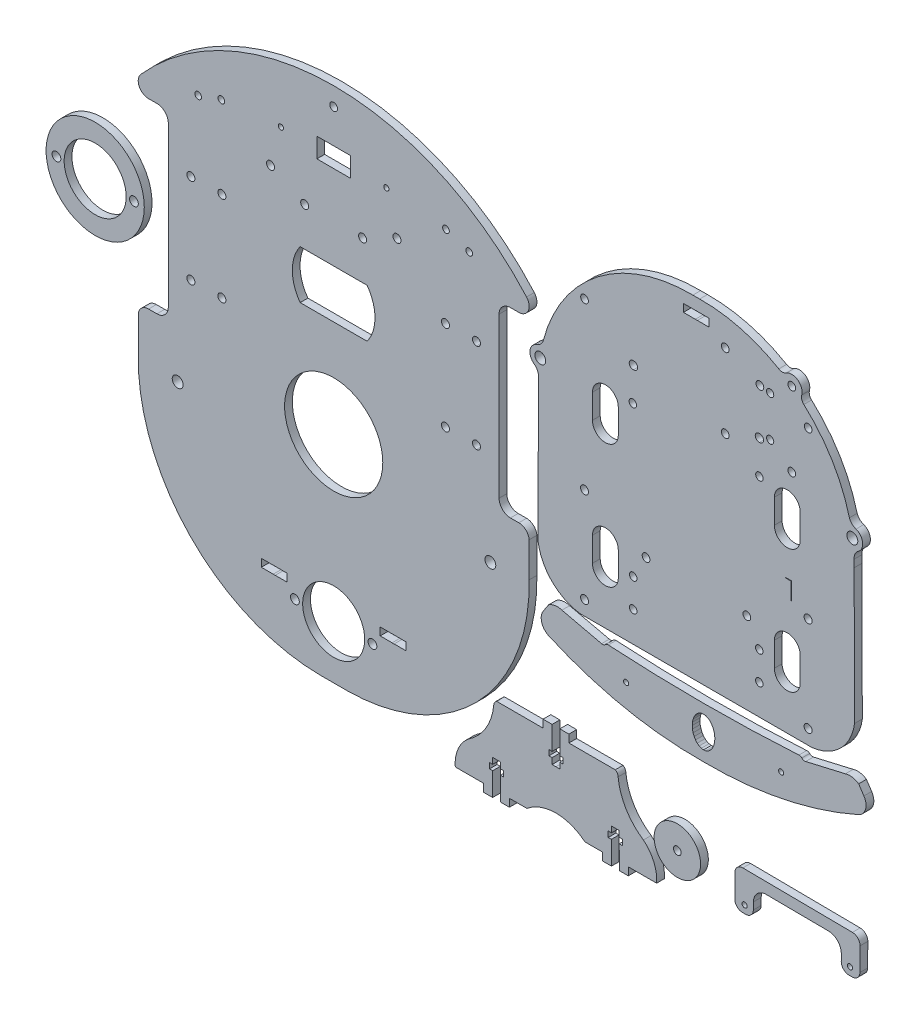
from build123d import *

# Parameters (mm, degrees)
MODEL_R               = 1.699983
MODEL_R_2             = 12
MODEL_R_3             = 2.1
MODEL_R_4             = 19
MODEL_R_5             = 1.55
MODEL_R_6             = 1.3
MODEL_R_7             = 1
MODEL_W               = 13
MODEL_H               = 7.6
MODEL_R_8             = 1.5
BOSS_EXTRUDE1_DEPTH   = 3
MODEL_R_9             = 1.45
MODEL_R_10            = 1.400097478
MODEL_R_11            = 1.500441699
MODEL_R_12            = 1.399540764
BOSS_EXTRUDE1_2_DEPTH = 3
BOSS_EXTRUDE1_3_DEPTH = 3
BOSS_EXTRUDE1_4_DEPTH = 3
BOSS_EXTRUDE1_5_DEPTH = 3
MODEL_R_13            = 9
BOSS_EXTRUDE1_6_DEPTH = 3
BOSS_EXTRUDE1_7_DEPTH = 3


with BuildPart() as part:
    # Model → Boss-Extrude1 (new body)
    with BuildSketch(Plane.XY):
        with BuildLine():
            Line((813.505926674, 140.108329038), (813.505926674, 201.796283999))
            ThreePointArc((813.505926674, 201.796283999), (814.796354345, 204.911651986), (817.911722332, 206.202079658))
            Line((817.911722332, 206.202079658), (821.147949544, 206.202079658))
            ThreePointArc((821.147949544, 206.202079658), (824.798296467, 208.564256212), (824.138971465, 212.861953418))
            ThreePointArc((824.138971465, 212.861953418), (749.503192804, 246.381695406), (674.867414142, 212.861953418))
            ThreePointArc((674.867414142, 212.861953418), (674.208089141, 208.564256212), (677.858436064, 206.202079658))
            Line((677.858436064, 206.202079658), (681.094663275, 206.202079658))
            ThreePointArc((681.094663275, 206.202079658), (684.210031262, 204.911651986), (685.500458934, 201.796283999))
            Line((685.500458934, 201.796283999), (685.500458934, 140.108329038))
            ThreePointArc((685.500458934, 140.108329038), (684.209895956, 136.992634392), (681.09420131, 135.702071414))
            Line((681.09420131, 135.702071414), (677.866731501, 135.702071414))
            ThreePointArc((677.866731501, 135.702071414), (675.134308532, 134.625733906), (673.870013854, 131.975036511))
            Line((673.870013854, 131.975036511), (673.870013854, 118.558895729))
            ThreePointArc((673.870013854, 118.558895729), (693.951774589, 67.659471727), (744.285774281, 46.199812992))
            Line((744.285774281, 46.199812992), (749.503192804, 46.199785203))
            Line((749.503192804, 46.199785203), (754.720611326, 46.199812992))
            ThreePointArc((754.720611326, 46.199812992), (805.054611018, 67.659471727), (825.136371753, 118.558895729))
            Line((825.136371753, 118.558895729), (825.136371753, 131.975036511))
            ThreePointArc((825.136371753, 131.975036511), (823.872077075, 134.625733906), (821.139654106, 135.702071414))
            Line((821.139654106, 135.702071414), (817.912184297, 135.702071414))
            ThreePointArc((817.912184297, 135.702071414), (814.796489652, 136.992634392), (813.505926674, 140.108329038))
        make_face()
        with Locations((734.502945377, 66.762651685)):
            Circle(MODEL_R, mode=Mode.SUBTRACT)
        with BuildLine():
            Line((731.502611288, 73.962833599), (731.502611288, 70.962833599))
            Line((731.502611288, 70.962833599), (726.893130503, 70.962838298))
            ThreePointArc((726.893130503, 70.962838298), (726.502608179, 70.912836148), (726.112085956, 70.962839094))
            Line((726.112085956, 70.962839094), (721.50260823, 70.962843794))
            Line((721.50260823, 70.962843794), (721.50260823, 73.962833599))
            Line((721.50260823, 73.962833599), (726.112087485, 73.962833599))
            ThreePointArc((726.112087485, 73.962833599), (726.502609759, 74.012836148), (726.893132033, 73.962833599))
            Line((726.893132033, 73.962833599), (731.502611288, 73.962833599))
        make_face(mode=Mode.SUBTRACT)
        with Locations((749.502795377, 66.762651685)):
            Circle(MODEL_R_2, mode=Mode.SUBTRACT)
        with Locations((764.502645377, 66.762651685)):
            Circle(MODEL_R, mode=Mode.SUBTRACT)
        with BuildLine():
            Line((772.112085956, 70.962838298), (767.502605171, 70.962833599))
            Line((767.502605171, 70.962833599), (767.502605171, 73.962833599))
            Line((767.502605171, 73.962833599), (772.112084426, 73.962833599))
            ThreePointArc((772.112084426, 73.962833599), (772.5026067, 74.012836148), (772.893128974, 73.962833599))
            Line((772.893128974, 73.962833599), (777.50260823, 73.962833599))
            Line((777.50260823, 73.962833599), (777.50260823, 70.962843794))
            Line((777.50260823, 70.962843794), (772.893130503, 70.962839094))
            ThreePointArc((772.893130503, 70.962839094), (772.502608281, 70.912836148), (772.112085956, 70.962838298))
        make_face(mode=Mode.SUBTRACT)
        with Locations((689.120060972, 116.936022379)):
            Circle(MODEL_R_3, mode=Mode.SUBTRACT)
        with Locations((749.5, 129.5)):
            Circle(MODEL_R_4, mode=Mode.SUBTRACT)
        with Locations((810.131525065, 116.936022379)):
            Circle(MODEL_R_3, mode=Mode.SUBTRACT)
        with Locations((694.236958178, 153.599764702)):
            Circle(MODEL_R_5, mode=Mode.SUBTRACT)
        with Locations((706.236958178, 153.599764702)):
            Circle(MODEL_R_5, mode=Mode.SUBTRACT)
        with Locations((694.236958178, 188.299764702)):
            Circle(MODEL_R_5, mode=Mode.SUBTRACT)
        with Locations((706.236958178, 188.299764702)):
            Circle(MODEL_R_5, mode=Mode.SUBTRACT)
        with Locations((792.763770316, 153.599764702)):
            Circle(MODEL_R_5, mode=Mode.SUBTRACT)
        with BuildLine():
            Line((736.51769824, 185.924782019), (762.453003098, 185.930215033))
            ThreePointArc((762.453003098, 185.930215033), (765.487313655, 176.558551757), (762.456929776, 167.185618031))
            Line((762.456929776, 167.185618031), (736.521624913, 167.180185031))
            ThreePointArc((736.521624913, 167.180185031), (733.487314362, 176.5518483), (736.51769824, 185.924782019))
        make_face(mode=Mode.SUBTRACT)
        with Locations((792.763770316, 188.299764702)):
            Circle(MODEL_R_5, mode=Mode.SUBTRACT)
        with Locations((697.05410976, 216.862387)):
            Circle(MODEL_R_6, mode=Mode.SUBTRACT)
        with Locations((706.041717574, 219.927474111)):
            Circle(MODEL_R_6, mode=Mode.SUBTRACT)
        with Locations((738.285350665, 200.947214569)):
            Circle(MODEL_R_5, mode=Mode.SUBTRACT)
        with Locations((725.070137431, 207.45155957)):
            Circle(MODEL_R_5, mode=Mode.SUBTRACT)
        with Locations((760.685350665, 200.947214569)):
            Circle(MODEL_R_5, mode=Mode.SUBTRACT)
        with Locations((773.997959275, 207.45155957)):
            Circle(MODEL_R_5, mode=Mode.SUBTRACT)
        with Locations((792.951231186, 219.927474111)):
            Circle(MODEL_R_6, mode=Mode.SUBTRACT)
        with Locations((729.080559, 222.300895)):
            Circle(MODEL_R_7, mode=Mode.SUBTRACT)
        with Locations((749.500559, 222.390895)):
            Rectangle(MODEL_W, MODEL_H, mode=Mode.SUBTRACT)
        with Locations((749.500364247, 239.307685207)):
            Circle(MODEL_R_8, mode=Mode.SUBTRACT)
        with Locations((769.890559, 222.300895)):
            Circle(MODEL_R_7, mode=Mode.SUBTRACT)
        with BuildLine():
            ThreePointArc((804.766598873, 152.049767283), (803.213770316, 153.599764702), (804.766598873, 155.149762121))
            ThreePointArc((804.766598873, 155.149762121), (806.31942743, 153.599764702), (804.766598873, 152.049767283))
        make_face(mode=Mode.SUBTRACT)
        with BuildLine():
            ThreePointArc((804.766598873, 186.749767283), (803.213770316, 188.299764702), (804.766598873, 189.849762121))
            ThreePointArc((804.766598873, 189.849762121), (806.31942743, 188.299764702), (804.766598873, 186.749767283))
        make_face(mode=Mode.SUBTRACT)
        with Locations((801.938839, 216.862387)):
            Circle(MODEL_R_6, mode=Mode.SUBTRACT)
    extrude(amount=BOSS_EXTRUDE1_DEPTH)


with BuildPart() as body_2:
    # Model → Boss-Extrude1 2 (new body)
    with BuildSketch(Plane.XY):
        with BuildLine():
            ThreePointArc((828.019169648, 198.865929929), (825.473459804, 195.684803573), (827.036886758, 191.922370895))
            Line((827.036886758, 191.922370895), (827.153385217, 191.838380374))
            ThreePointArc((827.153385217, 191.838380374), (828.381780538, 190.326060373), (828.750002865, 188.412822499))
            ThreePointArc((828.750002865, 188.412822499), (828.728333367, 186.954388993), (828.736669157, 185.495818333))
            Line((828.736669157, 185.495818333), (828.576129041, 133.41184207))
            ThreePointArc((828.576129041, 133.41184207), (834.028668277, 122.408065424), (845.099727706, 117.0934697))
            Line((845.099727706, 117.0934697), (889.827824399, 117.095278562))
            Line((889.827824399, 117.095278562), (934.555920065, 117.0934697))
            ThreePointArc((934.555920065, 117.0934697), (945.626980929, 122.40806684), (951.079519488, 133.411845949))
            Line((951.079519488, 133.411845949), (950.918978871, 185.495818333))
            ThreePointArc((950.918978871, 185.495818333), (950.930427481, 186.94052377), (950.905843447, 188.385065392))
            ThreePointArc((950.905843447, 188.385065392), (951.274861511, 190.298149947), (952.503885741, 191.809958894))
            Line((952.503885741, 191.809958894), (952.620419124, 191.893900952))
            ThreePointArc((952.620419124, 191.893900952), (954.185410843, 195.655683032), (951.641024338, 198.837867944))
            ThreePointArc((951.641024338, 198.837867944), (950.064930579, 199.788094375), (949.081125391, 201.343449369))
            ThreePointArc((949.081125391, 201.343449369), (942.412542477, 217.224929219), (931.441674652, 230.503914853))
            ThreePointArc((931.441674652, 230.503914853), (930.644504711, 231.769533555), (930.626104063, 233.265171223))
            ThreePointArc((930.626104063, 233.265171223), (929.135923267, 237.503587618), (924.645378824, 237.644381628))
            ThreePointArc((924.645378824, 237.644381628), (923.213999775, 237.210302566), (921.766746484, 237.588096858))
            ThreePointArc((921.766746484, 237.588096858), (907.001554706, 243.731828095), (891.128890643, 245.684994056))
            Line((891.128890643, 245.684994056), (888.504080835, 245.685295761))
            ThreePointArc((888.504080835, 245.685295761), (851.883034586, 233.5530016), (830.585484528, 201.38612498))
            ThreePointArc((830.585484528, 201.38612498), (829.601577196, 199.821301039), (828.019169648, 198.865929929))
        make_face()
        with Locations((846.580903574, 122.720676153)):
            Circle(MODEL_R_5, mode=Mode.SUBTRACT)
        with Locations((865.414348545, 128.817857078)):
            Circle(MODEL_R_9, mode=Mode.SUBTRACT)
        with BuildLine():
            Line((859.645414831, 145.778264449), (859.645422146, 136.38834271))
            ThreePointArc((859.645422146, 136.38834271), (854.645426042, 131.388338815), (849.645422146, 136.38833492))
            Line((849.645422146, 136.38833492), (849.645414831, 145.778256658))
            ThreePointArc((849.645414831, 145.778256658), (854.645410935, 150.778260553), (859.645414831, 145.778264449))
        make_face(mode=Mode.SUBTRACT)
        with Locations((865.414348545, 139.817857078)):
            Circle(MODEL_R_9, mode=Mode.SUBTRACT)
        with Locations((914.214348545, 128.767857078)):
            Circle(MODEL_R_9, mode=Mode.SUBTRACT)
        with Locations((914.214348545, 139.767857078)):
            Circle(MODEL_R_9, mode=Mode.SUBTRACT)
        with Locations((933.107715713, 122.720676153)):
            Circle(MODEL_R_5, mode=Mode.SUBTRACT)
        with BuildLine():
            Line((920.043197141, 136.38834271), (920.043204456, 145.778264449))
            ThreePointArc((920.043204456, 145.778264449), (925.043208352, 150.778260553), (930.043204456, 145.778256658))
            Line((930.043204456, 145.778256658), (930.043197141, 136.38833492))
            ThreePointArc((930.043197141, 136.38833492), (925.043193245, 131.388338815), (920.043197141, 136.38834271))
        make_face(mode=Mode.SUBTRACT)
        with Locations((870.394493842, 148.665022583)):
            Circle(MODEL_R_8, mode=Mode.SUBTRACT)
        with Locations((846.580903574, 159.445923215)):
            Circle(MODEL_R_5, mode=Mode.SUBTRACT)
        with BuildLine():
            Line((859.645414831, 193.704304879), (859.645422146, 184.314383141))
            ThreePointArc((859.645422146, 184.314383141), (854.645426042, 179.314379246), (849.645422146, 184.31437535))
            Line((849.645422146, 184.31437535), (849.645414831, 193.704297089))
            ThreePointArc((849.645414831, 193.704297089), (854.645410935, 198.704300984), (859.645414831, 193.704304879))
        make_face(mode=Mode.SUBTRACT)
        with Locations((909.394493842, 148.665022583)):
            Circle(MODEL_R_8, mode=Mode.SUBTRACT)
        with Locations((933.107715713, 159.445923215)):
            Circle(MODEL_R_5, mode=Mode.SUBTRACT)
        Polygon((924.410972358, 168.813112568), (924.410972358, 169.014660167), (926.656349872, 169.014660167), (926.656349872, 162.278527624), (926.465873827, 162.278527624), (926.465873827, 168.813112568), align=None, mode=Mode.SUBTRACT)
        with BuildLine():
            Line((920.043197141, 184.314383141), (920.043204456, 193.704304879))
            ThreePointArc((920.043204456, 193.704304879), (925.043208352, 198.704300984), (930.043204456, 193.704297089))
            Line((930.043204456, 193.704297089), (930.043197141, 184.31437535))
            ThreePointArc((930.043197141, 184.31437535), (925.043193245, 179.314379246), (920.043197141, 184.314383141))
        make_face(mode=Mode.SUBTRACT)
        with Locations((829.464052955, 195.094491874)):
            Circle(MODEL_R_3, mode=Mode.SUBTRACT)
        with Locations((865.264348545, 197.817857078)):
            Circle(MODEL_R_9, mode=Mode.SUBTRACT)
        with BuildLine():
            ThreePointArc((865.509766214, 209.173630287), (863.87449399, 210.666850908), (865.508436822, 212.161526087))
            ThreePointArc((865.508436822, 212.161526087), (867.143709045, 210.668305466), (865.509766214, 209.173630287))
        make_face(mode=Mode.SUBTRACT)
        with Locations((846.580903574, 223.445923215)):
            Circle(MODEL_R_8, mode=Mode.SUBTRACT)
        with Locations((914.264348545, 197.767857078)):
            Circle(MODEL_R_9, mode=Mode.SUBTRACT)
        with Locations((901.037902401, 205.496875368)):
            Circle(MODEL_R_8, mode=Mode.SUBTRACT)
        with BuildLine():
            ThreePointArc((914.259877734, 212.163132936), (915.87449364, 210.666739774), (914.258325302, 209.172023439))
            ThreePointArc((914.258325302, 209.172023439), (912.643709396, 210.668416601), (914.259877734, 212.163132936))
        make_face(mode=Mode.SUBTRACT)
        with Locations((926.787902401, 205.496875368)):
            Circle(MODEL_R_8, mode=Mode.SUBTRACT)
        with Locations((950.225294826, 195.094491874)):
            Circle(MODEL_R_3, mode=Mode.SUBTRACT)
        with Locations((918.413058913, 212.141943186)):
            Circle(MODEL_R_10, mode=Mode.SUBTRACT)
        with Locations((914.445209695, 228.351138943)):
            Circle(MODEL_R_11, mode=Mode.SUBTRACT)
        with BuildLine():
            ThreePointArc((889.450582186, 241.064505146), (889.841081579, 241.114607282), (890.231607127, 241.064709422))
            Line((890.231607127, 241.064709422), (894.841094486, 241.065915031))
            Line((894.841094486, 241.065915031), (894.841879134, 238.065915134))
            Line((894.841879134, 238.065915134), (890.232391775, 238.064709525))
            ThreePointArc((890.232391775, 238.064709525), (889.841892383, 238.014607388), (889.451366835, 238.064505248))
            Line((889.451366835, 238.064505248), (884.841879476, 238.063299639))
            Line((884.841879476, 238.063299639), (884.841094828, 241.063299537))
            Line((884.841094828, 241.063299537), (889.450582186, 241.064505146))
        make_face(mode=Mode.SUBTRACT)
        with Locations((901.037902401, 234.296875368)):
            Circle(MODEL_R_8, mode=Mode.SUBTRACT)
        with Locations((933.107715713, 223.445923215)):
            Circle(MODEL_R_8, mode=Mode.SUBTRACT)
        with Locations((918.413211584, 227.809597413)):
            Circle(MODEL_R_12, mode=Mode.SUBTRACT)
        with Locations((926.787902401, 234.296875368)):
            Circle(MODEL_R_8, mode=Mode.SUBTRACT)
    extrude(amount=BOSS_EXTRUDE1_2_DEPTH)


with BuildPart() as body_3:
    # Model → Boss-Extrude1 3 (new body)
    with BuildSketch(Plane.XY):
        with BuildLine():
            ThreePointArc((952.618400028, 103.596026361), (955.343258494, 106.769997904), (954.702521289, 110.90381029))
            Line((954.702521289, 110.90381029), (952.670928809, 113.968666581))
            ThreePointArc((952.670928809, 113.968666581), (950.18826957, 114.970742443), (947.519688189, 114.755274729))
            Line((947.519688189, 114.755274729), (932.172066536, 111.200676976))
            ThreePointArc((932.172066536, 111.200676976), (931.366268376, 111.218620275), (930.686084525, 111.65103508))
            ThreePointArc((930.686084525, 111.65103508), (930.167968592, 111.983103753), (929.557642996, 112.061947844))
            ThreePointArc((929.557642996, 112.061947844), (892.663576086, 110.941819466), (855.769509176, 112.061947844))
            ThreePointArc((855.769509176, 112.061947844), (855.167872493, 111.978815429), (854.65750502, 111.649569718))
            ThreePointArc((854.65750502, 111.649569718), (853.977337837, 111.217128694), (853.171540371, 111.199154333))
            Line((853.171540371, 111.199154333), (837.823781708, 114.753160468))
            ThreePointArc((837.823781708, 114.753160468), (835.155192022, 114.968525315), (832.672571413, 113.966353753))
            Line((832.672571413, 113.966353753), (830.641097077, 110.901419151))
            ThreePointArc((830.641097077, 110.901419151), (830.000519222, 106.767582069), (832.725500034, 103.593715565))
            ThreePointArc((832.725500034, 103.593715565), (862.032980753, 94.202742704), (892.672186774, 91.311747764))
            ThreePointArc((892.672186774, 91.311747764), (923.311281332, 94.203923771), (952.618400028, 103.596026361))
        make_face()
        with Locations((862.668334441, 102.956811364)):
            Circle(MODEL_R_7, mode=Mode.SUBTRACT)
        Polygon((891.782840588, 107.202653527), (892.63595645, 107.317748247), (893.489072311, 107.202653527), (894.309403409, 106.861792394), (895.065424878, 106.308263949), (895.728083238, 105.56333998), (896.2719129, 104.655647498), (896.676014794, 103.620068616), (896.924859512, 102.496400048), (897.00888409, 101.327823749), (896.924859512, 100.15924745), (896.676014794, 99.035578883), (896.2719129, 98), (895.728083238, 97.092307518), (895.065424878, 96.347383549), (894.309403409, 95.793855104), (893.489072311, 95.452993971), (892.63595645, 95.337899251), (891.782840588, 95.452993971), (890.962509491, 95.793855104), (890.206488022, 96.347383549), (889.543829662, 97.092307518), (889, 98), (888.595898106, 99.035578883), (888.347053388, 100.15924745), (888.263028809, 101.327823749), (888.347053388, 102.496400048), (888.595898106, 103.620068616), (889, 104.655647498), (889.543829662, 105.56333998), (890.206488022, 106.308263949), (890.962509491, 106.861792394), align=None, mode=Mode.SUBTRACT)
        with Locations((922.675390412, 102.956811364)):
            Circle(MODEL_R_7, mode=Mode.SUBTRACT)
    extrude(amount=BOSS_EXTRUDE1_3_DEPTH)


with BuildPart() as body_4:
    # Model → Boss-Extrude1 4 (new body)
    with BuildSketch(Plane.XY):
        with BuildLine():
            Line((838.265981511, 63.393446358), (837.015964511, 63.432910358))
            Line((837.015964511, 63.432910358), (837.016959511, 61.112910358))
            Line((837.016959511, 61.112910358), (835.516959511, 61.112266358))
            Line((835.516959511, 61.112266358), (834.016959511, 61.112910358))
            Line((834.016959511, 61.112910358), (834.017953887, 63.431455722))
            Line((834.017953887, 63.431455722), (832.767937513, 63.391991742))
            Line((832.767937513, 63.391991742), (832.768889513, 65.611990742))
            Line((832.768889513, 65.611990742), (834.01883191, 65.475454808))
            Line((834.01883191, 65.475454808), (834.02259451, 74.572906311))
            Line((834.02259451, 74.572906311), (830.522595513, 74.572902742))
            Line((830.522595513, 74.572902742), (830.522598571, 71.572906565))
            Line((830.522598571, 71.572906565), (812.553409447, 71.572639656))
            ThreePointArc((812.553409447, 71.572639656), (811.776450404, 70.78793842), (811.451054984, 69.73269475))
            ThreePointArc((811.451054984, 69.73269475), (808.40140223, 60.517501349), (801.688800138, 53.506000477))
            ThreePointArc((801.688800138, 53.506000477), (797.64845628, 48.173086887), (796.553759891, 41.572633442))
            Line((796.553759891, 41.572633442), (807.516959511, 41.572633442))
            Line((807.516959511, 41.572633442), (807.516959511, 38.545074663))
            Line((807.516959511, 38.545074663), (811.016106632, 38.544159462))
            Line((811.016106632, 38.544159462), (811.020104238, 47.541631363))
            Line((811.020104238, 47.541631363), (809.769983238, 47.505617363))
            Line((809.769983238, 47.505617363), (809.777062238, 49.725605363))
            Line((809.777062238, 49.725605363), (811.026928238, 49.681620363))
            Line((811.026928238, 49.681620363), (811.034326238, 52.001608363))
            Line((811.034326238, 52.001608363), (812.534318238, 51.996825363))
            Line((812.534318238, 51.996825363), (814.034310238, 52.001608363))
            Line((814.034310238, 52.001608363), (814.041708238, 49.681620363))
            Line((814.041708238, 49.681620363), (815.291574238, 49.725605363))
            Line((815.291574238, 49.725605363), (815.298653238, 47.505617363))
            Line((815.298653238, 47.505617363), (814.048532238, 47.541631363))
            Line((814.048532238, 47.541631363), (814.052530196, 38.543365288))
            Line((814.052530196, 38.543365288), (817.516959169, 38.542459168))
            Line((817.516959169, 38.542459168), (817.517742826, 41.53866651))
            Line((817.517742826, 41.53866651), (824.295997062, 41.53836367))
            ThreePointArc((824.295997062, 41.53836367), (829.557315448, 44.541796821), (835.516959002, 45.63025011))
            ThreePointArc((835.516959002, 45.63025011), (841.472779884, 44.543171941), (846.728124267, 41.537361443))
            Line((846.728124267, 41.537361443), (853.516567412, 41.537058147))
            Line((853.516567412, 41.537058147), (853.517351068, 38.540850805))
            Line((853.517351068, 38.540850805), (856.981780041, 38.541756924))
            Line((856.981780041, 38.541756924), (856.985778, 47.540023))
            Line((856.985778, 47.540023), (855.735657, 47.504009))
            Line((855.735657, 47.504009), (855.742736, 49.723997))
            Line((855.742736, 49.723997), (856.992602, 49.680012))
            Line((856.992602, 49.680012), (857, 52))
            Line((857, 52), (858.499992, 51.995217))
            Line((858.499992, 51.995217), (859.999984, 52))
            Line((859.999984, 52), (860.007382, 49.680012))
            Line((860.007382, 49.680012), (861.257248, 49.723997))
            Line((861.257248, 49.723997), (861.264327, 47.504009))
            Line((861.264327, 47.504009), (860.014206, 47.540023))
            Line((860.014206, 47.540023), (860.018203606, 38.542551099))
            Line((860.018203606, 38.542551099), (863.51735059, 38.543989398))
            Line((863.51735059, 38.543989398), (863.516559137, 41.572633442))
            Line((863.516559137, 41.572633442), (874.480159132, 41.572633442))
            ThreePointArc((874.480159132, 41.572633442), (873.385462743, 48.173086887), (869.345118885, 53.506000477))
            ThreePointArc((869.345118885, 53.506000477), (862.628291972, 60.524526722), (859.582466542, 69.74940731))
            ThreePointArc((859.582466542, 69.74940731), (859.252881199, 70.794981928), (858.480159113, 71.572640823))
            Line((858.480159113, 71.572640823), (840.522598571, 71.572912937))
            Line((840.522598571, 71.572912937), (840.522595513, 74.572912937))
            Line((840.522595513, 74.572912937), (837.011324511, 74.572909358))
            Line((837.011324511, 74.572909358), (837.015086511, 65.476909358))
            Line((837.015086511, 65.476909358), (838.265029511, 65.613445358))
            Line((838.265029511, 65.613445358), (838.265981511, 63.393446358))
        make_face()
    extrude(amount=BOSS_EXTRUDE1_4_DEPTH)


with BuildPart() as body_5:
    # Model → Boss-Extrude1 5 (new body)
    with BuildSketch(Plane.XY):
        with BuildLine():
            Line((953.126422846, 50.945581732), (953.211056962, 59.945183782))
            ThreePointArc((953.211056962, 59.945183782), (952.352364611, 62.074673248), (950.239400984, 62.973262505))
            Line((950.239400984, 62.973262505), (907.831240518, 63.372077604))
            ThreePointArc((907.831240518, 63.372077604), (905.701751052, 62.513385253), (904.803161796, 60.400421626))
            Line((904.803161796, 60.400421626), (904.718527679, 51.400819576))
            ThreePointArc((904.718527679, 51.400819576), (905.577220031, 49.27133011), (907.690183657, 48.372740854))
            Line((907.690183657, 48.372740854), (908.890130597, 48.361456305))
            ThreePointArc((908.890130597, 48.361456305), (911.019620063, 49.220148656), (911.91820932, 51.333112283))
            Line((911.91820932, 51.333112283), (911.94141227, 54.040569413))
            ThreePointArc((911.94141227, 54.040569413), (913.434402003, 57.564153185), (916.981655146, 59))
            Line((916.981655146, 59), (940.984674244, 58.806019775))
            ThreePointArc((940.984674244, 58.806019775), (944.508258016, 57.313030042), (945.944104831, 53.765776899))
            Line((945.944104831, 53.765776899), (945.926741206, 51.013289025))
            ThreePointArc((945.926741206, 51.013289025), (946.785433557, 48.88379956), (948.898397184, 47.985210303))
            Line((948.898397184, 47.985210303), (950.098344124, 47.973925754))
            ThreePointArc((950.098344124, 47.973925754), (952.227833589, 48.832618106), (953.126422846, 50.945581732))
        make_face()
        with Locations((908.517923465, 51.311111087)):
            Circle(MODEL_R_7, mode=Mode.SUBTRACT)
        with Locations((949.326590869, 50.981316137)):
            Circle(MODEL_R_7, mode=Mode.SUBTRACT)
    extrude(amount=BOSS_EXTRUDE1_5_DEPTH)


with BuildPart() as body_6:
    # Model → Boss-Extrude1 6 (new body)
    with BuildSketch(Plane.XY):
        with Locations((882.5, 56.5)):
            Circle(MODEL_R_13)
        with Locations((882.5, 56.5)):
            Circle(MODEL_R_8, mode=Mode.SUBTRACT)
    extrude(amount=BOSS_EXTRUDE1_6_DEPTH)


with BuildPart() as body_7:
    # Model → Boss-Extrude1 7 (new body)
    with BuildSketch(Plane.XY):
        with Locations((657.20324152, 168.981102802)):
            Circle(MODEL_R_4)
        with Locations((642.20339152, 168.981102802)):
            Circle(MODEL_R, mode=Mode.SUBTRACT)
        with Locations((657.20324152, 168.981102802)):
            Circle(MODEL_R_2, mode=Mode.SUBTRACT)
        with Locations((672.20309152, 168.981102802)):
            Circle(MODEL_R, mode=Mode.SUBTRACT)
    extrude(amount=BOSS_EXTRUDE1_7_DEPTH)


solid = Compound([part.part, body_2.part, body_3.part, body_4.part, body_5.part, body_6.part, body_7.part])
